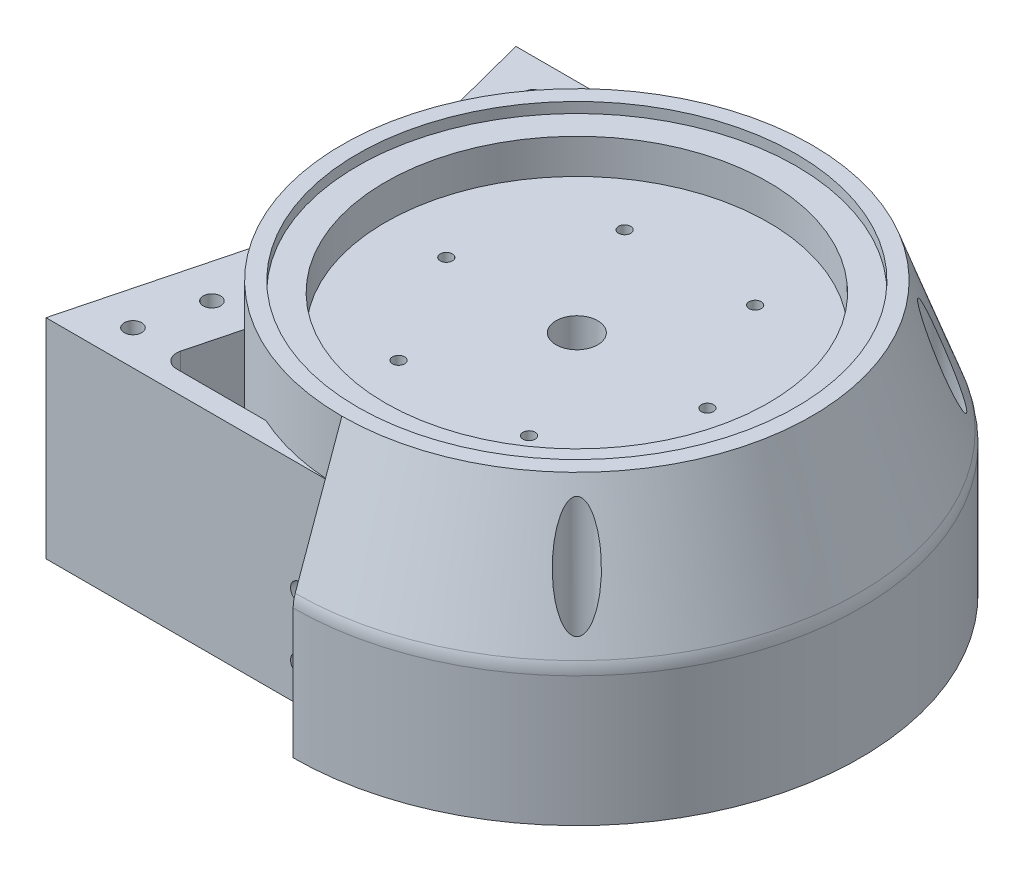
from build123d import *

# Parameters (mm, degrees)
SALIENTE_EXTRUIR1_DEPTH     = 110
CORTAR_EXTRUIR1_DEPTH       = 102
REDONDEO1_R                 = 2
REDONDEO2_R                 = 5
CROQUIS3_W                  = 57
CROQUIS3_H                  = 57
CORTAR_EXTRUIR2_DEPTH       = 5
CROQUIS4_R                  = 6
CORTAR_EXTRUIR3_DEPTH       = 100
CROQUIS5_R                  = 3
CORTAR_EXTRUIR4_DEPTH       = 100
CORTAR_EXTRUIR5_START       = -32
CORTAR_EXTRUIR5_DEPTH       = 32
SALIENTE_EXTRUIR2_DEPTH     = 23
CORTAR_EXTRUIR6_DEPTH       = 102
CROQUIS10_W                 = 57
CROQUIS10_H                 = 57
CORTAR_EXTRUIR7_DEPTH       = 5
CORTAR_EXTRUIR8_DEPTH       = 189.690884782
CORTAR_EXTRUIR8_DEPTH_BACK  = 3
CROQUIS11_R                 = 63
CROQUIS12_R                 = 55
CORTAR_EXTRUIR9_DEPTH       = 13
CROQUIS13_R                 = 1.5
CORTAR_EXTRUIR10_DEPTH      = 14
CROQUIS14_R                 = 1.75
CORTAR_EXTRUIR11_DEPTH      = 6
MATRIZC1_COUNT              = 6
CROQUIS17_R                 = 2.75
CORTAR_EXTRUIR12_DEPTH      = 30
CROQUIS18_R                 = 3.35
CORTAR_EXTRUIR13_DEPTH      = 5
CROQUIS16_R                 = 2.75
CORTAR_EXTRUIR14_DEPTH      = 30
CROQUIS19_R                 = 3.35
CORTAR_EXTRUIR15_DEPTH      = 5
CORTAR_EXTRUIR16_DEPTH      = 202.102585802
CORTAR_EXTRUIR16_DEPTH_BACK = 202.102585802
CROQUIS22_R                 = 3
CORTAR_EXTRUIR17_START      = 30
CROQUIS23_R                 = 5
CORTAR_EXTRUIR17_DEPTH      = 193.025336429
CORTAR_EXTRUIR18_DEPTH      = 223.025336429
CORTAR_EXTRUIR19_START      = 60
CORTAR_EXTRUIR19_DEPTH      = 82.248893914
CROQUIS28_R                 = 2.5
CORTAR_EXTRUIR20_DEPTH      = 25
CROQUIS29_R                 = 2.75
CORTAR_EXTRUIR21_DEPTH      = 6.6
CROQUIS30_R                 = 2.5
CORTAR_EXTRUIR22_DEPTH      = 45
CORTAR_EXTRUIR23_DEPTH      = 133.163724283
CORTAR_EXTRUIR24_START      = -25
CORTAR_EXTRUIR24_DEPTH      = 4.2
CORTAR_EXTRUIR25_REACH      = 193.364
CROQUIS33_W                 = 8
CROQUIS33_H                 = 1
REDONDEO3_R                 = 1


# Read off the part's stored shape, not the designer's step: Simetría1
with BuildPart() as part:
    # Croquis1 → Saliente-Extruir1 (new body)
    with BuildSketch(Plane(origin=(0, 0, 0), x_dir=(1, 0, 0), z_dir=(0, 1, 0))):
        with BuildLine():
            Line((-158, 67.5), (0, 67.5))
            ThreePointArc((0, 67.5), (67.5, 0), (0, -67.5))
            Line((0, -67.5), (-158, -67.5))
            Line((-158, -67.5), (-158, 67.5))
        make_face()
    extrude(amount=SALIENTE_EXTRUIR1_DEPTH)

    # Croquis2 → Cortar-Extruir1 (cut)
    with BuildSketch(Plane(origin=(0, 110, 0), x_dir=(1, 0, 0), z_dir=(0, 1, 0))):
        Polygon((-140, 59.5), (-103, 59.5), (-103, 49.5), (-93, 49.5), (-93, 12.5), (-103, 12.5), (-103, 2.5), (-140, 2.5), (-140, 12.5), (-150, 12.5), (-150, 49.5), (-140, 49.5), align=None)
    extrude(amount=-CORTAR_EXTRUIR1_DEPTH, mode=Mode.SUBTRACT)

    # Redondeo1
    redondeo1_edges = [part.edges().sort_by_distance(p)[0] for p in [
        (-150, 59, -12.5),
        (-150, 59, -49.5),
        (-140, 59, -59.5),
        (-103, 59, -59.5),
        (-93, 59, -49.5),
        (-93, 59, -12.5),
        (-103, 59, -2.5),
        (-140, 59, -2.5),
    ]]
    fillet(redondeo1_edges, radius=REDONDEO1_R)

    # Redondeo2
    redondeo2_edges = [part.edges().sort_by_distance(p)[0] for p in [
        (-140, 59, -12.5),
        (-140, 59, -49.5),
        (-103, 59, -49.5),
        (-103, 59, -12.5),
    ]]
    fillet(redondeo2_edges, radius=REDONDEO2_R)

    # Croquis3 → Cortar-Extruir2 (cut)
    with BuildSketch(Plane(origin=(0, 110, 0), x_dir=(1, 0, 0), z_dir=(0, 1, 0))):
        with Locations((-121.5, 31)):
            Rectangle(CROQUIS3_W, CROQUIS3_H)
    extrude(amount=-CORTAR_EXTRUIR2_DEPTH, mode=Mode.SUBTRACT)

    # Croquis4 → Cortar-Extruir3 (cut)
    with BuildSketch(Plane(origin=(0, 110, 0), x_dir=(1, 0, 0), z_dir=(0, 1, 0))):
        with Locations(Location((0, 0, 0), (0, 0, 270))):
            Circle(CROQUIS4_R)
    extrude(amount=-CORTAR_EXTRUIR3_DEPTH, mode=Mode.SUBTRACT)

    # Croquis5 → Cortar-Extruir4 (cut)
    with BuildSketch(Plane(origin=(0, 110, 0), x_dir=(1, 0, 0), z_dir=(0, 1, 0))):
        with Locations(Location((-76.5, 0, 0), (0, 0, 270))):
            Circle(CROQUIS5_R)
    extrude(amount=-CORTAR_EXTRUIR4_DEPTH, mode=Mode.SUBTRACT)

    # Croquis6 → Cortar-Extruir5 (cut)
    with BuildSketch(Plane(origin=(0, 110, 0), x_dir=(1, 0, 0), z_dir=(0, 1, 0)).offset(CORTAR_EXTRUIR5_START)):
        with BuildLine():
            Line((-68.150642634, 2.509621588), (-85, 67.5))
            Line((-85, 67.5), (0, 67.5))
            ThreePointArc((0, 67.5), (67.5, 0), (0, -67.5))
            Line((0, -67.5), (-85, -67.5))
            Line((-85, -67.5), (-68.150642634, -2.509621588))
            ThreePointArc((-68.150642634, -2.509621588), (-67.830611616, 0), (-68.150642634, 2.509621588))
        make_face()
    extrude(amount=CORTAR_EXTRUIR5_DEPTH, mode=Mode.SUBTRACT)

    # Croquis7 → Saliente-Extruir2 (add)
    with BuildSketch(Plane(origin=(0, 110, 0), x_dir=(1, 0, 0), z_dir=(0, 1, 0))):
        with BuildLine():
            Line((-70.817153658, -12.794735536), (-85, -67.5))
            Line((-85, -67.5), (-158, -67.5))
            Line((-158, -67.5), (-158, 2.5))
            Line((-158, 2.5), (-93, 2.5))
            Line((-93, 2.5), (-89.253692234, -5.774368745))
            ThreePointArc((-89.253692234, -5.774368745), (-81.482027989, -13.083554453), (-70.817153658, -12.794735536))
        make_face()
    extrude(amount=SALIENTE_EXTRUIR2_DEPTH)

    # Croquis8 → Cortar-Extruir6 (cut)
    with BuildSketch(Plane(origin=(0, 133, 0), x_dir=(1, 0, 0), z_dir=(0, 1, 0))):
        with BuildLine():
            Line((-105, -59.5), (-138, -59.5))
            ThreePointArc((-138, -59.5), (-139.414213562, -58.914213562), (-140, -57.5))
            Line((-140, -57.5), (-140, -54.5))
            ThreePointArc((-140, -54.5), (-141.464466094, -50.964466094), (-145, -49.5))
            Line((-145, -49.5), (-148, -49.5))
            ThreePointArc((-148, -49.5), (-149.414213562, -48.914213562), (-150, -47.5))
            Line((-150, -47.5), (-150, -14.5))
            ThreePointArc((-150, -14.5), (-149.414213562, -13.085786438), (-148, -12.5))
            Line((-148, -12.5), (-145, -12.5))
            ThreePointArc((-145, -12.5), (-141.464466094, -11.035533906), (-140, -7.5))
            Line((-140, -7.5), (-140, -4.5))
            ThreePointArc((-140, -4.5), (-139.414213562, -3.085786438), (-138, -2.5))
            Line((-138, -2.5), (-105, -2.5))
            ThreePointArc((-105, -2.5), (-103.585786438, -3.085786438), (-103, -4.5))
            Line((-103, -4.5), (-103, -7.5))
            ThreePointArc((-103, -7.5), (-101.535533906, -11.035533906), (-98, -12.5))
            Line((-98, -12.5), (-95, -12.5))
            ThreePointArc((-95, -12.5), (-93.585786438, -13.085786438), (-93, -14.5))
            Line((-93, -14.5), (-93, -47.5))
            ThreePointArc((-93, -47.5), (-93.585786438, -48.914213562), (-95, -49.5))
            Line((-95, -49.5), (-98, -49.5))
            ThreePointArc((-98, -49.5), (-101.535533906, -50.964466094), (-103, -54.5))
            Line((-103, -54.5), (-103, -57.5))
            ThreePointArc((-103, -57.5), (-103.585786438, -58.914213562), (-105, -59.5))
        make_face()
    extrude(amount=-CORTAR_EXTRUIR6_DEPTH, mode=Mode.SUBTRACT)

    # Croquis10 → Cortar-Extruir7 (cut)
    with BuildSketch(Plane(origin=(0, 133, 0), x_dir=(1, 0, 0), z_dir=(0, 1, 0))):
        with Locations((-121.5, -31)):
            Rectangle(CROQUIS10_W, CROQUIS10_H)
    extrude(amount=-CORTAR_EXTRUIR7_DEPTH, mode=Mode.SUBTRACT)

    # Croquis11 → Cortar-Extruir8 (cut, two sides: drawn at the far end of the back side and taken through both)
    with BuildSketch(Plane(origin=(0, 78, 0), x_dir=(1, 0, 0), z_dir=(0, 1, 0)).offset(-CORTAR_EXTRUIR8_DEPTH_BACK)):
        with Locations(Location((0, 0, 0), (0, 0, 270))):
            Circle(CROQUIS11_R)
    extrude(amount=CORTAR_EXTRUIR8_DEPTH + CORTAR_EXTRUIR8_DEPTH_BACK, mode=Mode.SUBTRACT)

    # Croquis12 → Cortar-Extruir9 (cut)
    with BuildSketch(Plane(origin=(0, 78, 0), x_dir=(1, 0, 0), z_dir=(0, 1, 0))):
        with Locations(Location((0, 0, 0), (0, 0, 270))):
            Circle(CROQUIS12_R)
    extrude(amount=-CORTAR_EXTRUIR9_DEPTH, mode=Mode.SUBTRACT)

    # Croquis13 → Cortar-Extruir10 (cut)
    with BuildSketch(Plane(origin=(0, 65, 0), x_dir=(1, 0, 0), z_dir=(0, 1, 0))):
        with Locations(Location((-37.5, 0, 0), (0, 0, 270))):
            Circle(CROQUIS13_R)
    cortar_extruir10 = extrude(amount=-CORTAR_EXTRUIR10_DEPTH, mode=Mode.SUBTRACT)

    # Croquis14 → Cortar-Extruir11 (cut)
    with BuildSketch(Plane(origin=(0, 65, 0), x_dir=(1, 0, 0), z_dir=(0, 1, 0))):
        with Locations(Location((-37.5, 0, 0), (0, 0, 270))):
            Circle(CROQUIS14_R)
    cortar_extruir11 = extrude(amount=-CORTAR_EXTRUIR11_DEPTH, mode=Mode.SUBTRACT)

    # MatrizC1: Cortar-Extruir10, Cortar-Extruir11 ×6 about axis
    matrizc1_axis = Axis((0, 0, 0), (0, 1, 0))
    add([cortar_extruir10.rotate(matrizc1_axis, i * 360 / MATRIZC1_COUNT) for i in range(1, MATRIZC1_COUNT)], mode=Mode.SUBTRACT)
    add([cortar_extruir11.rotate(matrizc1_axis, i * 360 / MATRIZC1_COUNT) for i in range(1, MATRIZC1_COUNT)], mode=Mode.SUBTRACT)

    # Croquis17 → Cortar-Extruir12 (cut)
    with BuildSketch(Plane(origin=(0, 133, 0), x_dir=(1, 0, 0), z_dir=(0, 1, 0))):
        with Locations(Location((-145, -54.5, 0), (0, 0, 270))):
            Circle(CROQUIS17_R)
        with Locations(Location((-98, -54.5, 0), (0, 0, 270))):
            Circle(CROQUIS17_R)
        with Locations(Location((-98, -7.5, 0), (0, 0, 270))):
            Circle(CROQUIS17_R)
        with Locations(Location((-145, -7.5, 0), (0, 0, 270))):
            Circle(CROQUIS17_R)
    extrude(amount=-CORTAR_EXTRUIR12_DEPTH, mode=Mode.SUBTRACT)

    # Croquis18 → Cortar-Extruir13 (cut)
    with BuildSketch(Plane(origin=(0, 128, 0), x_dir=(1, 0, 0), z_dir=(0, 1, 0))):
        with Locations(Location((-145, -7.5, 0), (0, 0, 270))):
            Circle(CROQUIS18_R)
        with Locations(Location((-98, -7.5, 0), (0, 0, 270))):
            Circle(CROQUIS18_R)
        with Locations(Location((-98, -54.5, 0), (0, 0, 270))):
            Circle(CROQUIS18_R)
        with Locations(Location((-145, -54.5, 0), (0, 0, 270))):
            Circle(CROQUIS18_R)
    extrude(amount=-CORTAR_EXTRUIR13_DEPTH, mode=Mode.SUBTRACT)

    # Croquis16 → Cortar-Extruir14 (cut)
    with BuildSketch(Plane(origin=(0, 110, 0), x_dir=(1, 0, 0), z_dir=(0, 1, 0))):
        with Locations(Location((-98, 7.5, 0), (0, 0, 270))):
            Circle(CROQUIS16_R)
        with Locations(Location((-145, 7.5, 0), (0, 0, 270))):
            Circle(CROQUIS16_R)
        with Locations(Location((-98, 54.5, 0), (0, 0, 270))):
            Circle(CROQUIS16_R)
        with Locations(Location((-145, 54.5, 0), (0, 0, 270))):
            Circle(CROQUIS16_R)
    extrude(amount=-CORTAR_EXTRUIR14_DEPTH, mode=Mode.SUBTRACT)

    # Croquis19 → Cortar-Extruir15 (cut)
    with BuildSketch(Plane(origin=(0, 105, 0), x_dir=(1, 0, 0), z_dir=(0, 1, 0))):
        with Locations(Location((-145, 54.5, 0), (0, 0, 270))):
            Circle(CROQUIS19_R)
        with Locations(Location((-98, 54.5, 0), (0, 0, 270))):
            Circle(CROQUIS19_R)
        with Locations(Location((-145, 7.5, 0), (0, 0, 270))):
            Circle(CROQUIS19_R)
        with Locations(Location((-98, 7.5, 0), (0, 0, 270))):
            Circle(CROQUIS19_R)
    extrude(amount=-CORTAR_EXTRUIR15_DEPTH, mode=Mode.SUBTRACT)

    # Barrer1: sweep along a path in Croquis20
    with BuildLine(Plane.XZ) as barrer1_path:
        Line((-158, -67.5), (0, -67.5))
        ThreePointArc((0, -67.5), (67.5, 0), (0, 67.5))
        Line((0, 67.5), (-158, 67.5))
    # Croquis21 → Barrer1 (sweep)
    with BuildSketch(Plane(origin=(-158, 0, 0), x_dir=(0, 0, -1), z_dir=(1, 0, 0))):
        with BuildLine():
            Line((-67.5, 0), (-81.5, 0))
            Line((-81.5, 0), (-81.5, 37.259500921))
            ThreePointArc((-81.5, 37.259500921), (-81.351889846, 38.974221441), (-80.911946708, 40.638148457))
            Line((-80.911946708, 40.638148457), (-67.5, 78))
            Line((-67.5, 78), (-67.5, 39))
            Line((-67.5, 39), (-67.5, 0))
        make_face()
    sweep(path=barrer1_path.line)

    # Croquis22 → Cortar-Extruir16 (cut, two sides: drawn at the far end of the back side and taken through both)
    with BuildSketch(Plane(origin=(0, 39, 0), x_dir=(-1, 0, 0), z_dir=(0, -1, 0)).offset(-CORTAR_EXTRUIR16_DEPTH_BACK)):
        with Locations(Location((118.5, 74.205973354, 0), (0, 0, 90))):
            Circle(CROQUIS22_R)
        with Locations(Location((39.5, 74.205973354, 0), (0, 0, 90))):
            Circle(CROQUIS22_R)
        with Locations(Location((-52.471546963, 52.471546963, 0), (0, 0, 90))):
            Circle(CROQUIS22_R)
        with Locations(Location((118.5, -74.205973354, 0), (0, 0, 270))):
            Circle(CROQUIS22_R)
        with Locations(Location((39.5, -74.205973354, 0), (0, 0, 270))):
            Circle(CROQUIS22_R)
        with Locations(Location((-52.471546963, -52.471546963, 0), (0, 0, 225))):
            Circle(CROQUIS22_R)
    extrude(amount=CORTAR_EXTRUIR16_DEPTH + CORTAR_EXTRUIR16_DEPTH_BACK, mode=Mode.SUBTRACT)

    # Croquis23 → Cortar-Extruir17 (cut, through all)
    with BuildSketch(Plane(origin=(0, 0, 0), x_dir=(1, 0, 0), z_dir=(0, 1, 0)).offset(CORTAR_EXTRUIR17_START)):
        with Locations(Location((-118.5, 74.205973354, 0), (0, 0, 90))):
            Circle(CROQUIS23_R)
        with Locations(Location((-39.5, 74.205973354, 0), (0, 0, 90))):
            Circle(CROQUIS23_R)
        with Locations(Location((52.471546963, 52.471546963, 0), (0, 0, 85.474739491))):
            Circle(CROQUIS23_R)
        with Locations(Location((52.471546963, -52.471546963, 0), (0, 0, 90))):
            Circle(CROQUIS23_R)
        with Locations(Location((-39.5, -74.205973354, 0), (0, 0, 90))):
            Circle(CROQUIS23_R)
        with Locations(Location((-118.5, -74.205973354, 0), (0, 0, 90))):
            Circle(CROQUIS23_R)
    extrude(amount=CORTAR_EXTRUIR17_DEPTH, mode=Mode.SUBTRACT)

    # Croquis25 → Cortar-Extruir18 (cut, through all)
    with BuildSketch(Plane(origin=(0, 0, 0), x_dir=(1, 0, 0), z_dir=(0, 1, 0))):
        with BuildLine():
            Line((-85, 67.5), (-68.150642634, 2.509621588))
            ThreePointArc((-68.150642634, 2.509621588), (-67.830611616, 0), (-68.150642634, -2.509621588))
            Line((-68.150642634, -2.509621588), (-85, -67.5))
            Line((-85, -67.5), (0, -67.5))
            Line((0, -67.5), (0, -105.12057115))
            add(Edge.make_bspline(
                [(0, -105.12057115), (-292.601457756, -314.784435991), (-275.638516536, 323.101608779), (0, 97.247041743)],
                knots=[0, 0, 0, 0, 1, 1, 1, 1], degree=3))
            Line((0, 97.247041743), (0, 67.5))
            Line((0, 67.5), (-85, 67.5))
        make_face()
    extrude(amount=CORTAR_EXTRUIR18_DEPTH, mode=Mode.SUBTRACT)

    # Croquis26 → Cortar-Extruir19 (cut, through all)
    with BuildSketch(Plane(origin=(0, 0, 0), x_dir=(1, 0, 0), z_dir=(0, 1, 0)).offset(CORTAR_EXTRUIR19_START)):
        with BuildLine():
            ThreePointArc((0, 67.5), (-67.5, 0), (0, -67.5))
            add(Edge.make_bspline(
                [(0, 67.5), (-181.920027596, 227.287517888), (-171.384632901, -221.380769394), (0, -67.5)],
                knots=[0, 0, 0, 0, 1, 1, 1, 1], degree=3))
        make_face()
    extrude(amount=CORTAR_EXTRUIR19_DEPTH, mode=Mode.SUBTRACT)

    # Croquis28 → Cortar-Extruir20 (cut)
    with BuildSketch(Plane(origin=(0, 0, -67.5), x_dir=(-1, 0, 0), z_dir=(0, 0, -1))):
        with Locations((12, 10)):
            Circle(CROQUIS28_R)
        with Locations((12, 28)):
            Circle(CROQUIS28_R)
    extrude(amount=-CORTAR_EXTRUIR20_DEPTH, mode=Mode.SUBTRACT)

    # Croquis29 → Cortar-Extruir21 (cut)
    with BuildSketch(Plane(origin=(0, 0, -67.5), x_dir=(-1, 0, 0), z_dir=(0, 0, -1))):
        with Locations((12, 28)):
            Circle(CROQUIS29_R)
        with Locations((12, 10)):
            Circle(CROQUIS29_R)
    extrude(amount=-CORTAR_EXTRUIR21_DEPTH, mode=Mode.SUBTRACT)

    # Croquis30 → Cortar-Extruir22 (cut)
    with BuildSketch(Plane(origin=(0, 60, 0), x_dir=(1, 0, 0), z_dir=(0, 1, 0))):
        with Locations(Location((-70.010673469, 57.5, 0), (0, 0, 270))):
            Circle(CROQUIS30_R)
        with Locations(Location((-65.344006802, 39.5, 0), (0, 0, 270))):
            Circle(CROQUIS30_R)
    extrude(amount=-CORTAR_EXTRUIR22_DEPTH, mode=Mode.SUBTRACT)

    # Croquis31 → Cortar-Extruir23 (cut, through all)
    with BuildSketch(Plane(origin=(0, 60, 0), x_dir=(1, 0, 0), z_dir=(0, 1, 0))):
        with BuildLine():
            Line((-27.820855486, 61.5), (-53.481694884, 61.5))
            ThreePointArc((-53.481694884, 61.5), (-56.645189355, 59.94791804), (-57.353682477, 56.496151365))
            Line((-57.353682477, 56.496151365), (-53.408087822, 41.277429125))
            ThreePointArc((-53.408087822, 41.277429125), (-41.854192155, 52.957309213), (-27.820855486, 61.5))
        make_face()
    extrude(amount=-CORTAR_EXTRUIR23_DEPTH, mode=Mode.SUBTRACT)

    # Croquis32 → Cortar-Extruir24 (cut)
    with BuildSketch(Plane(origin=(0, 60, 0), x_dir=(1, 0, 0), z_dir=(0, 1, 0)).offset(CORTAR_EXTRUIR24_START)):
        Polygon((-65.276401261, 57.5), (-67.643537365, 61.6), (-83.47037037, 61.6), (-81.344444444, 53.4), (-67.643537365, 53.4), align=None)
        Polygon((-60.609734595, 39.5), (-62.976870698, 43.6), (-78.803703704, 43.6), (-76.677777778, 35.4), (-62.976870698, 35.4), align=None)
    extrude(amount=-CORTAR_EXTRUIR24_DEPTH, mode=Mode.SUBTRACT)

    # Croquis33 → Cortar-Extruir25 (cut, up to next)
    with BuildSketch(Plane(origin=(-63.248714653, 0, 16.39781491), x_dir=(0.25096215878372596, 0, 0.9679968981658009), z_dir=(-0.9679968981658009, 0, 0.25096215878372596)), mode=Mode.PRIVATE) as cortar_extruir25_sk1:
        with Locations((-65.081703248, 0.5)):
            Rectangle(CROQUIS33_W, CROQUIS33_H)
    cortar_extruir25_tool1 = extrude(cortar_extruir25_sk1.sketch, amount=-CORTAR_EXTRUIR25_REACH, mode=Mode.PRIVATE) & part.part
    add(cortar_extruir25_tool1.solids().sort_by_distance((-79.581759, 0.5, -46.601072))[0], mode=Mode.SUBTRACT)

    # Redondeo3
    # the kernel refuses this fillet: 1 mm, written as the material it adds along each edge
    with BuildSketch(Plane(origin=(-78.577910762, 1, -42.729084369), x_dir=(0, -1, 0), z_dir=(0.9679968981658009, 0, -0.25096215878372596)), Plane(origin=(-80.585608033, 1, -50.473059554), x_dir=(0.25096215878372596, 0, 0.9679968981658009), z_dir=(0.9679968981658009, 0, -0.25096215878372596))) as redondeo3_piece_1:
        with BuildLine():
            CenterArc((REDONDEO3_R, REDONDEO3_R), REDONDEO3_R, 180, 90)
            Line((0, REDONDEO3_R), (0, 0))
            Line((0, 0), (REDONDEO3_R, 0))
        make_face()
    extrude(amount=24)

    # Simetría1
    split(bisect_by=Plane(origin=(0, 0, 0), x_dir=(1, 0, 0), z_dir=(0, 0, -1)), keep=Keep.TOP)

    # Simetr_a1 2: part across plane


with BuildPart() as part_1:
    add(part.part)
    add(part.part.mirror(Plane(origin=(0, 0, 0), x_dir=(1, 0, 0), z_dir=(0, 0, -1))))


solid = part_1.part
